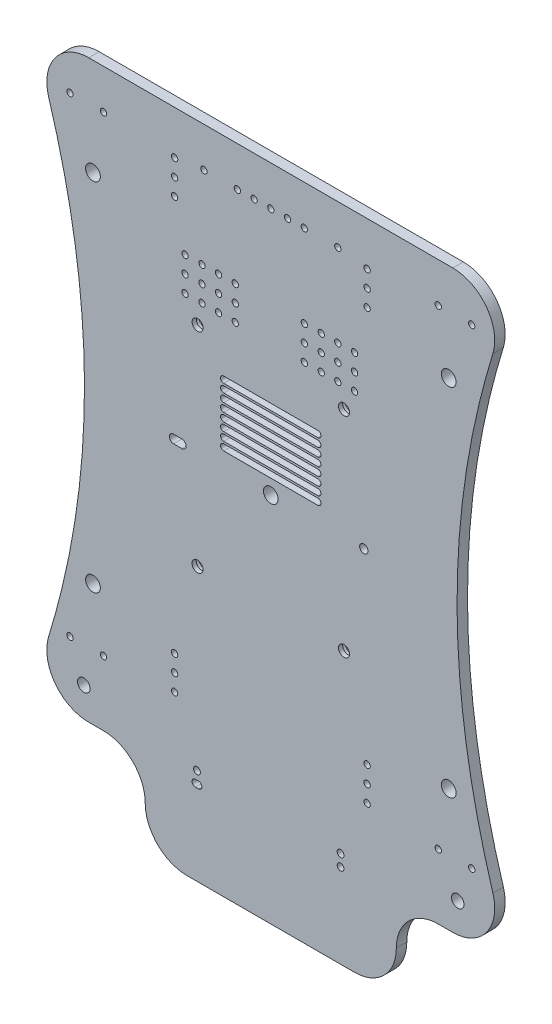
from build123d import *

# Parameters (mm, degrees)
SKETCH_1_W          = 333.133614648
SKETCH_1_H          = 408.025988762
EXTRUDE_1_DEPTH     = 5
SKETCH_2_R          = 1.513425055
SKETCH_2_R_2        = 3.525566515
SKETCH_2_R_3        = 2.642926273
SKETCH_2_R_4        = 3.5
SKETCH_2_R_5        = 1.6383
SKETCH_2_R_6        = 1.60655
SKETCH_2_R_7        = 1.984375
CUT_EXTRUDE_1_DEPTH = 390.365109421
SKETCH_3_R          = 5
CUT_EXTRUDE_2_DEPTH = 3
SKETCH_4_OUTSIDE_W  = 440.488
SKETCH_4_OUTSIDE_H  = 515.38
CUT_EXTRUDE_3_DEPTH = 390.365109421
FILLET_1_R          = 20
FILLET_2_R          = 20
CUT_EXTRUDE_4_DEPTH = 341.914998774
SKETCH_6_R          = 3
CUT_EXTRUDE_5_DEPTH = 341.914998774


with BuildPart() as part:
    # 草图1 → 凸台-拉伸1 (new body)
    with BuildSketch(Plane.XY):
        with Locations((53, -117.5)):
            Rectangle(SKETCH_1_W, SKETCH_1_H)
    extrude(amount=EXTRUDE_1_DEPTH)

    # 草图2 → 切除-拉伸1 (cut, through all)
    with BuildSketch(Plane(origin=(0, 0, 0), x_dir=(-1, 0, 0), z_dir=(0, 0, -1))):
        with Locations((-148.988965471, -4.992353349)):
            Circle(SKETCH_2_R)
        with Locations((-133, -5)):
            Circle(SKETCH_2_R)
        with Locations((26.997460535, -4.998592438)):
            Circle(SKETCH_2_R)
        with Locations((42.986426006, -5.00623909)):
            Circle(SKETCH_2_R)
        with Locations((-149, -230)):
            Circle(SKETCH_2_R)
        with Locations((-133, -230)):
            Circle(SKETCH_2_R)
        with Locations((27, -230)):
            Circle(SKETCH_2_R)
        with Locations((42.986426006, -230)):
            Circle(SKETCH_2_R)
        with Locations((-99, -212)):
            Circle(SKETCH_2_R)
        with Locations((-99, -220)):
            Circle(SKETCH_2_R)
        with Locations((-99, -228)):
            Circle(SKETCH_2_R)
        with Locations((-7, -228)):
            Circle(SKETCH_2_R)
        with Locations((-7, -212)):
            Circle(SKETCH_2_R)
        with Locations((-7, -220)):
            Circle(SKETCH_2_R)
        with Locations((-99, -6.871966514)):
            Circle(SKETCH_2_R)
        with Locations((-99, -14.871966514)):
            Circle(SKETCH_2_R)
        with Locations((-99, -22.871966514)):
            Circle(SKETCH_2_R)
        with Locations((-7, -22.871966514)):
            Circle(SKETCH_2_R)
        with Locations((-7, -6.871966514)):
            Circle(SKETCH_2_R)
        with Locations((-7, -14.871966514)):
            Circle(SKETCH_2_R)
        with Locations((-36, -60.5)):
            Circle(SKETCH_2_R)
        with Locations((-12, -44.5)):
            Circle(SKETCH_2_R)
        with Locations((-77.090901225, -52.5)):
            Circle(SKETCH_2_R)
        with Locations((-69, -60.5)):
            Circle(SKETCH_2_R)
        with Locations((-93, -44.5)):
            Circle(SKETCH_2_R)
        with Locations((-36, -44.5)):
            Circle(SKETCH_2_R)
        with Locations((-93, -60.5)):
            Circle(SKETCH_2_R)
        with Locations((-20.090901225, -44.5)):
            Circle(SKETCH_2_R)
        with Locations((-12, -60.5)):
            Circle(SKETCH_2_R)
        with Locations((-28, -52.5)):
            Circle(SKETCH_2_R)
        with Locations((-69, -44.5)):
            Circle(SKETCH_2_R)
        with Locations((-85, -60.5)):
            Circle(SKETCH_2_R)
        with Locations((-36, -52.5)):
            Circle(SKETCH_2_R)
        with Locations((-20.090901225, -52.5)):
            Circle(SKETCH_2_R)
        with Locations((-69, -52.5)):
            Circle(SKETCH_2_R)
        with Locations((-93, -52.5)):
            Circle(SKETCH_2_R)
        with Locations((-85, -44.5)):
            Circle(SKETCH_2_R)
        with Locations((-12, -52.5)):
            Circle(SKETCH_2_R)
        with Locations((-28, -44.5)):
            Circle(SKETCH_2_R)
        with Locations((-20.090901225, -60.5)):
            Circle(SKETCH_2_R)
        with Locations((-77.090901225, -44.5)):
            Circle(SKETCH_2_R)
        with Locations((-28, -60.5)):
            Circle(SKETCH_2_R)
        with Locations((-85, -52.5)):
            Circle(SKETCH_2_R)
        with Locations((-77.090901225, -60.5)):
            Circle(SKETCH_2_R)
        with Locations((-85, -5)):
            Circle(SKETCH_2_R)
        with Locations((-69, -5)):
            Circle(SKETCH_2_R)
        with Locations((-61, -5)):
            Circle(SKETCH_2_R)
        with Locations((-53, -5)):
            Circle(SKETCH_2_R)
        with Locations((-45, -5)):
            Circle(SKETCH_2_R)
        with Locations((-37, -5)):
            Circle(SKETCH_2_R)
        with Locations((-21, -5)):
            Circle(SKETCH_2_R)
        with Locations((32.013896377, -32.478539865)):
            Circle(SKETCH_2_R_2)
        with Locations((-138, -32.5)):
            Circle(SKETCH_2_R_2)
        with Locations((32.013896377, -202.640739345)):
            Circle(SKETCH_2_R_2)
        with Locations((-138, -202.5)):
            Circle(SKETCH_2_R_2)
        with Locations((-17.999324239, -70.542920954)):
            Circle(SKETCH_2_R_3)
        with Locations((-87.957073727, -70.5)):
            Circle(SKETCH_2_R_3)
        with Locations((-87.957073727, -170.5)):
            Circle(SKETCH_2_R_3)
        with Locations((-17.957073727, -170.5)):
            Circle(SKETCH_2_R_3)
        with Locations((-52.957073727, -123.5)):
            Circle(SKETCH_2_R_4)
        with Locations((-86.321996808, -255.150184677)):
            Circle(SKETCH_2_R_5)
        with Locations((-86.321996808, -260.738184677)):
            Circle(SKETCH_2_R_6)
        with Locations((-17.672758542, -255.150184677)):
            Circle(SKETCH_2_R_5)
        with Locations((-97.407073727, -123.5)):
            Circle(SKETCH_2_R_7)
        with BuildLine():
            Line((-16.936770276, -262.351358963), (-18.408746808, -262.351358963))
            ThreePointArc((-18.408746808, -262.351358963), (-20.021921094, -260.738184677), (-18.408746808, -259.125010391))
            Line((-18.408746808, -259.125010391), (-16.936770276, -259.125010391))
            ThreePointArc((-16.936770276, -259.125010391), (-15.32359599, -260.738184677), (-16.936770276, -262.351358963))
        make_face()
        with BuildLine():
            Line((-6.522698727, -125.505892513), (-10.491448727, -125.505892513))
            ThreePointArc((-10.491448727, -125.505892513), (-12.49734124, -123.5), (-10.491448727, -121.494107487))
            Line((-10.491448727, -121.494107487), (-6.522698727, -121.494107487))
            ThreePointArc((-6.522698727, -121.494107487), (-4.516806214, -123.5), (-6.522698727, -125.505892513))
        make_face()
    extrude(amount=-CUT_EXTRUDE_1_DEPTH, mode=Mode.SUBTRACT)

    # 草图3 → 切除-拉伸2 (cut)
    with BuildSketch(Plane(origin=(0, 0, 0), x_dir=(-1, 0, 0), z_dir=(0, 0, -1))):
        with Locations((-17.957073727, -170.5)):
            Circle(SKETCH_3_R)
        with Locations((-87.957073727, -170.5)):
            Circle(SKETCH_3_R)
        with Locations((-17.999324239, -70.542920954)):
            Circle(SKETCH_3_R)
        with Locations((-87.957073727, -70.542920954)):
            Circle(SKETCH_3_R)
    extrude(amount=-CUT_EXTRUDE_2_DEPTH, mode=Mode.SUBTRACT)

    # 草图4 outside → 切除-拉伸3 (cut, through all)
    with BuildSketch(Plane.XY.offset(5)):
        with Locations((53, -117.5)):
            Rectangle(SKETCH_4_OUTSIDE_W, SKETCH_4_OUTSIDE_H)
        with BuildLine():
            Line((167.957073727, -261), (112.957073727, -261))
            Line((112.957073727, -261), (112.957073727, -301))
            Line((112.957073727, -301), (-7.042926273, -301))
            Line((-7.042926273, -301), (-7.042926273, -261))
            Line((-7.042926273, -261), (-62.042926273, -261))
            add(Edge.make_bspline(
                [(-62.042926273, -261), (-10.092495878, -123.354602183), (-62.042926273, 14)],
                knots=[0, 0, 0, 1, 1, 1], degree=2))
            Line((-62.042926273, 14), (167.957073727, 14))
            add(Edge.make_bspline(
                [(167.957073727, -261), (116.006643332, -123.354602183), (167.957073727, 14)],
                knots=[0, 0, 0, 1, 1, 1], degree=2))
        make_face(mode=Mode.SUBTRACT)
    extrude(amount=-CUT_EXTRUDE_3_DEPTH, mode=Mode.SUBTRACT)

    # 圆角1
    fillet_1_edges = [part.edges().sort_by_distance(p)[0] for p in [
        (167.957073727, 14, 2.5),
        (-62.042926273, 14, 2.5),
        (-62.042926273, -261, 2.5),
        (167.957073727, -261, 2.5),
    ]]
    fillet(fillet_1_edges, radius=FILLET_1_R)

    # 圆角2
    # the kernel refuses this fillet: 20 mm, written as the material it adds along each edge
    with BuildSketch(Plane(origin=(-7.042926273, -261, 5), x_dir=(0, -1, 0), z_dir=(0, 0, -1)), Plane(origin=(112.957073727, -261, 5), x_dir=(1, 0, 0), z_dir=(0, 0, -1))) as fillet_2_piece_1:
        with BuildLine():
            CenterArc((FILLET_2_R, FILLET_2_R), FILLET_2_R, 180, 90)
            Line((0, FILLET_2_R), (-FILLET_2_R * 0.02, FILLET_2_R))
            Line((-FILLET_2_R * 0.02, FILLET_2_R), (-FILLET_2_R * 0.02, -FILLET_2_R * 0.02))
            Line((-FILLET_2_R * 0.02, -FILLET_2_R * 0.02), (FILLET_2_R, -FILLET_2_R * 0.02))
            Line((FILLET_2_R, -FILLET_2_R * 0.02), (FILLET_2_R, 0))
        make_face()
    extrude(amount=5)
    # the kernel refuses this fillet: 20 mm, written as the material it takes off along each edge
    with BuildSketch(Plane(origin=(-7.042926273, -301, 55), x_dir=(0, 1, 0), z_dir=(0, 0, -1)), Plane(origin=(112.957073727, -301, 55), x_dir=(-1, 0, 0), z_dir=(0, 0, -1))) as fillet_2_2_piece_1:
        with BuildLine():
            CenterArc((FILLET_2_R, FILLET_2_R), FILLET_2_R, 180, 90)
            Line((0, FILLET_2_R), (-FILLET_2_R * 0.02, FILLET_2_R))
            Line((-FILLET_2_R * 0.02, FILLET_2_R), (-FILLET_2_R * 0.02, -FILLET_2_R * 0.02))
            Line((-FILLET_2_R * 0.02, -FILLET_2_R * 0.02), (FILLET_2_R, -FILLET_2_R * 0.02))
            Line((FILLET_2_R, -FILLET_2_R * 0.02), (FILLET_2_R, 0))
        make_face()
    extrude(amount=105, mode=Mode.SUBTRACT)

    # 草图5 → 切除-拉伸4 (cut, through all)
    with BuildSketch(Plane(origin=(0, 0, 0), x_dir=(-1, 0, 0), z_dir=(0, 0, -1))):
        with BuildLine():
            Line((-75.457073727, -113.482576588), (-30.457073727, -113.482576588))
            ThreePointArc((-30.457073727, -113.482576588), (-28.957073727, -114.982576588), (-30.457073727, -116.482576588))
            Line((-30.457073727, -116.482576588), (-75.457073727, -116.482576588))
            ThreePointArc((-75.457073727, -116.482576588), (-76.957073727, -114.982576588), (-75.457073727, -113.482576588))
        make_face()
        with BuildLine():
            Line((-75.457073727, -109.482576588), (-30.457073727, -109.482576588))
            ThreePointArc((-30.457073727, -109.482576588), (-28.957073727, -110.982576588), (-30.457073727, -112.482576588))
            Line((-30.457073727, -112.482576588), (-75.457073727, -112.482576588))
            ThreePointArc((-75.457073727, -112.482576588), (-76.957073727, -110.982576588), (-75.457073727, -109.482576588))
        make_face()
        with BuildLine():
            Line((-75.457073727, -105.482576588), (-30.457073727, -105.482576588))
            ThreePointArc((-30.457073727, -105.482576588), (-28.957073727, -106.982576588), (-30.457073727, -108.482576588))
            Line((-30.457073727, -108.482576588), (-75.457073727, -108.482576588))
            ThreePointArc((-75.457073727, -108.482576588), (-76.957073727, -106.982576588), (-75.457073727, -105.482576588))
        make_face()
        with BuildLine():
            Line((-75.457073727, -101.482576588), (-30.457073727, -101.482576588))
            ThreePointArc((-30.457073727, -101.482576588), (-28.957073727, -102.982576588), (-30.457073727, -104.482576588))
            Line((-30.457073727, -104.482576588), (-75.457073727, -104.482576588))
            ThreePointArc((-75.457073727, -104.482576588), (-76.957073727, -102.982576588), (-75.457073727, -101.482576588))
        make_face()
        with BuildLine():
            Line((-75.457073727, -97.482576588), (-30.457073727, -97.482576588))
            ThreePointArc((-30.457073727, -97.482576588), (-28.957073727, -98.982576588), (-30.457073727, -100.482576588))
            Line((-30.457073727, -100.482576588), (-75.457073727, -100.482576588))
            ThreePointArc((-75.457073727, -100.482576588), (-76.957073727, -98.982576588), (-75.457073727, -97.482576588))
        make_face()
        with BuildLine():
            Line((-75.457073727, -93.482576588), (-30.457073727, -93.482576588))
            ThreePointArc((-30.457073727, -93.482576588), (-28.957073727, -94.982576588), (-30.457073727, -96.482576588))
            Line((-30.457073727, -96.482576588), (-75.457073727, -96.482576588))
            ThreePointArc((-75.457073727, -96.482576588), (-76.957073727, -94.982576588), (-75.457073727, -93.482576588))
        make_face()
        with BuildLine():
            Line((-75.457073727, -89.482576588), (-30.457073727, -89.482576588))
            ThreePointArc((-30.457073727, -89.482576588), (-28.957073727, -90.982576588), (-30.457073727, -92.482576588))
            Line((-30.457073727, -92.482576588), (-75.457073727, -92.482576588))
            ThreePointArc((-75.457073727, -92.482576588), (-76.957073727, -90.982576588), (-75.457073727, -89.482576588))
        make_face()
        with BuildLine():
            Line((-75.457073727, -85.482576588), (-30.457073727, -85.482576588))
            ThreePointArc((-30.457073727, -85.482576588), (-28.957073727, -86.982576588), (-30.457073727, -88.482576588))
            Line((-30.457073727, -88.482576588), (-75.457073727, -88.482576588))
            ThreePointArc((-75.457073727, -88.482576588), (-76.957073727, -86.982576588), (-75.457073727, -85.482576588))
        make_face()
    extrude(amount=-CUT_EXTRUDE_4_DEPTH, mode=Mode.SUBTRACT)

    # 草图6 → 切除-拉伸5 (cut, through all)
    with BuildSketch(Plane.XY.offset(5)):
        with Locations((-36.394269724, -246.799791484)):
            Circle(SKETCH_6_R)
        with Locations((142.308417178, -246.799791484)):
            Circle(SKETCH_6_R)
    extrude(amount=-CUT_EXTRUDE_5_DEPTH, mode=Mode.SUBTRACT)


solid = part.part
